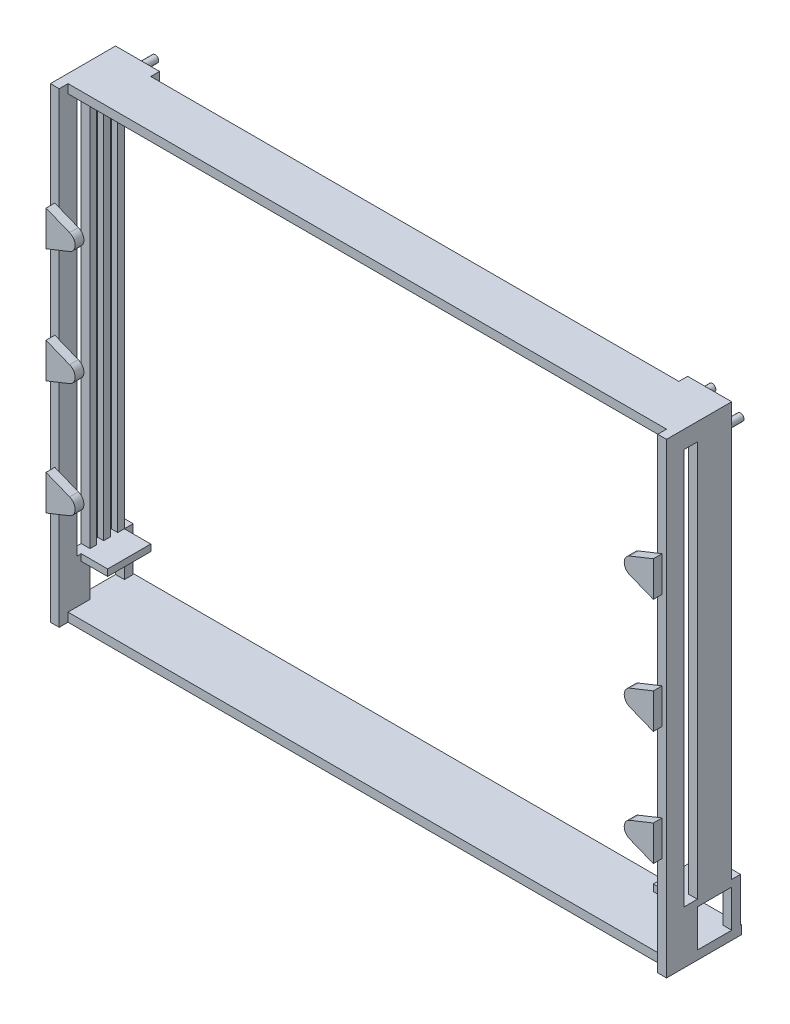
from build123d import *

# Parameters (mm, degrees)
ESQUISSE1_W                  = 10
ESQUISSE1_H                  = 25
BOSS_EXTRU_1_DEPTH           = 530
BOSS_EXTRU_1_2_DEPTH         = 530
BOSS_EXTRU_4_DEPTH           = 10
ESQUISSE8_W                  = 10
ESQUISSE8_H                  = 10
BOSS_EXTRU_5_DEPTH           = 60
ESQUISSE9_W                  = 60
ESQUISSE9_H                  = 10
BOSS_EXTRU_6_DEPTH           = 690
CONG_1_R                     = 10
CONG_2_R                     = 10
CONG_3_R                     = 10
CONG_4_R                     = 10
ESQUISSE10_W                 = 680
ESQUISSE10_H                 = 10
BOSS_EXTRU_7_DEPTH           = 15
ESQUISSE11_W                 = 10
ESQUISSE11_H                 = 50
BOSS_EXTRU_8_DEPTH           = 10
ESQUISSE12_W                 = 10
ESQUISSE12_H                 = 7.5
BOSS_EXTRU_9_DEPTH           = 39
ESQUISSE13_W                 = 49
ESQUISSE13_H                 = 7.5
BOSS_EXTRU_10_DEPTH          = 30
ESQUISSE19_W                 = 49
ESQUISSE19_H                 = 7.5
BOSS_EXTRU_14_DEPTH          = 30
ESQUISSE14_W                 = 10
ESQUISSE14_H                 = 49
BOSS_EXTRU_11_DEPTH          = 470
ESQUISSE16_W                 = 10
ESQUISSE16_H                 = 10
BOSS_EXTRU_12_DEPTH          = 20
ESQUISSE20_W                 = 10
ESQUISSE20_H                 = 10
BOSS_EXTRU_15_DEPTH          = 20
BOSS_EXTRU_16_REACH          = 876.2
ESQUISSE21_W                 = 54
ESQUISSE21_H                 = 10
ENL_V_MAT_EXTRU_1_DEPTH      = 875.199633951
ENL_V_MAT_EXTRU_1_DEPTH_BACK = 875.199633951
ESQUISSE22_W                 = 15
ESQUISSE22_H                 = 450
ESQUISSE23_W                 = 10
ESQUISSE23_H                 = 7.5
BOSS_EXTRU_17_DEPTH          = 10
BOSS_EXTRU_18_REACH          = 853.605
ESQUISSE24_W                 = 10
ESQUISSE24_H                 = 10
ESQUISSE25_W                 = 10
ESQUISSE25_H                 = 7.5
BOSS_EXTRU_19_DEPTH          = 10
BOSS_EXTRU_20_REACH          = 853.605
ESQUISSE26_W                 = 10
ESQUISSE26_H                 = 10
ESQUISSE28_W                 = 8
ESQUISSE28_H                 = 450
ENL_V_MAT_EXTRU_2_DEPTH      = 7
ESQUISSE29_W                 = 8
ESQUISSE29_H                 = 450
ENL_V_MAT_EXTRU_3_DEPTH      = 7
ESQUISSE31_W                 = 20
ESQUISSE31_H                 = 10
BOSS_EXTRU_22_DEPTH          = 10
ESQUISSE33_R                 = 4
BOSS_EXTRU_23_DEPTH          = 8
ESQUISSE34_R                 = 4
BOSS_EXTRU_24_DEPTH          = 15
ESQUISSE35_R                 = 4
BOSS_EXTRU_25_DEPTH          = 15
ESQUISSE36_R                 = 4
BOSS_EXTRU_26_DEPTH          = 8


with BuildPart() as part:
    # Esquisse1 → Boss.-Extru.1 (new body)
    with BuildSketch(Plane(origin=(0, 0, 0), x_dir=(1, 0, 0), z_dir=(0, 1, 0))):
        with Locations((5, 12.5)):
            Rectangle(ESQUISSE1_W, ESQUISSE1_H)
    extrude(amount=BOSS_EXTRU_1_DEPTH)

    # Esquisse7 → Boss.-Extru.4 (add)
    with BuildSketch(Plane.XY):
        Polygon((5, 415), (55, 395), (5, 375), align=None)
        Polygon((5, 285), (55, 265), (5, 245), align=None)
        Polygon((5, 155), (55, 135), (5, 115), align=None)
        Polygon((695, 115), (695, 155), (645, 135), align=None)
        Polygon((695, 245), (695, 285), (645, 265), align=None)
        Polygon((695, 375), (695, 415), (645, 395), align=None)
    extrude(amount=BOSS_EXTRU_4_DEPTH)


with BuildPart() as body_2:
    # Esquisse1 → Boss.-Extru.1 2 (new body)
    with BuildSketch(Plane(origin=(0, 0, 0), x_dir=(1, 0, 0), z_dir=(0, 1, 0))):
        with Locations((695, 12.5)):
            Rectangle(ESQUISSE1_W, ESQUISSE1_H)
    extrude(amount=BOSS_EXTRU_1_2_DEPTH)



with BuildPart() as boss_extru_4_piece_1:
    # of the separate pieces the step leaves, piece 1, a body of its own (boss_extru_4_pieces)
    add(part.part.solids().sort_by_distance((0, 0, 0))[0])

    # Esquisse8 → Boss.-Extru.5 (add)
    with BuildSketch(Plane(origin=(0, 0, -25), x_dir=(-1, 0, 0), z_dir=(0, 0, -1))):
        with Locations((-5, 5)):
            Rectangle(ESQUISSE8_W, ESQUISSE8_H)
    extrude(amount=BOSS_EXTRU_5_DEPTH)


with BuildPart() as boss_extru_4_piece_2:
    # of the separate pieces the step leaves, piece 2, a body of its own (boss_extru_4_pieces)
    add(part.part.solids().sort_by_distance((695, 115, 0))[0])

    # Congé4
    cong_4_edges = [boss_extru_4_piece_2.edges().sort_by_distance(p)[0] for p in [
        (645, 135, 5),
    ]]
    fillet(cong_4_edges, radius=CONG_4_R)


with BuildPart() as boss_extru_4_piece_3:
    # of the separate pieces the step leaves, piece 3, a body of its own (boss_extru_4_pieces)
    add(part.part.solids().sort_by_distance((695, 245, 0))[0])

    # Congé3
    cong_3_edges = [boss_extru_4_piece_3.edges().sort_by_distance(p)[0] for p in [
        (645, 265, 5),
    ]]
    fillet(cong_3_edges, radius=CONG_3_R)


with BuildPart() as boss_extru_4_piece_4:
    # of the separate pieces the step leaves, piece 4, a body of its own (boss_extru_4_pieces)
    add(part.part.solids().sort_by_distance((695, 375, 0))[0])

    # Congé2
    cong_2_edges = [boss_extru_4_piece_4.edges().sort_by_distance(p)[0] for p in [
        (645, 395, 5),
    ]]
    fillet(cong_2_edges, radius=CONG_2_R)


with BuildPart() as body_2_1:
    add(body_2.part)

    add(boss_extru_4_piece_1.part)  # Boss.-Extru.6 merges Boss.-Extru.4 piece 1
    # Esquisse9 → Boss.-Extru.6 (add)
    with BuildSketch(Plane(origin=(10, 0, 0), x_dir=(0, 0, -1), z_dir=(1, 0, 0))):
        with Locations((55, 5)):
            Rectangle(ESQUISSE9_W, ESQUISSE9_H)
    extrude(amount=BOSS_EXTRU_6_DEPTH)

    # Congé1
    cong_1_edges = [body_2_1.edges().sort_by_distance(p)[0] for p in [
        (55, 395, 5),
        (55, 135, 5),
        (55, 265, 5),
    ]]
    fillet(cong_1_edges, radius=CONG_1_R)

    # Esquisse10 → Boss.-Extru.7 (add)
    with BuildSketch(Plane.XY.offset(-25)):
        with Locations((350, 5)):
            Rectangle(ESQUISSE10_W, ESQUISSE10_H)
    extrude(amount=BOSS_EXTRU_7_DEPTH)

    # Esquisse11 → Boss.-Extru.8 (add)
    with BuildSketch(Plane(origin=(0, 0, -25), x_dir=(-1, 0, 0), z_dir=(0, 0, -1))):
        with Locations((-695, 35)):
            Rectangle(ESQUISSE11_W, ESQUISSE11_H)
        with Locations((-5, 35)):
            Rectangle(ESQUISSE11_W, ESQUISSE11_H)
    extrude(amount=BOSS_EXTRU_8_DEPTH)

    # Esquisse12 → Boss.-Extru.9 (add)
    with BuildSketch(Plane(origin=(0, 0, -35), x_dir=(-1, 0, 0), z_dir=(0, 0, -1))):
        with Locations((-695, 56.25)):
            Rectangle(ESQUISSE12_W, ESQUISSE12_H)
        with Locations((-5, 56.25)):
            Rectangle(ESQUISSE12_W, ESQUISSE12_H)
    extrude(amount=BOSS_EXTRU_9_DEPTH)

    # Esquisse13 → Boss.-Extru.10 (add)
    with BuildSketch(Plane.ZY.offset(-690)):
        with Locations((-49.5, 56.25)):
            Rectangle(ESQUISSE13_W, ESQUISSE13_H)
    extrude(amount=BOSS_EXTRU_10_DEPTH)

    # Esquisse19 → Boss.-Extru.14 (add)
    with BuildSketch(Plane(origin=(10, 0, 0), x_dir=(0, 0, -1), z_dir=(1, 0, 0))):
        with Locations((49.5, 56.25)):
            Rectangle(ESQUISSE19_W, ESQUISSE19_H)
    extrude(amount=BOSS_EXTRU_14_DEPTH)

    # Esquisse14 → Boss.-Extru.11 (add)
    with BuildSketch(Plane(origin=(0, 60, 0), x_dir=(1, 0, 0), z_dir=(0, 1, 0))):
        with Locations((695, 49.5)):
            Rectangle(ESQUISSE14_W, ESQUISSE14_H)
        with Locations((5, 49.5)):
            Rectangle(ESQUISSE14_W, ESQUISSE14_H)
    extrude(amount=BOSS_EXTRU_11_DEPTH)

    # Esquisse16 → Boss.-Extru.12 (add)
    with BuildSketch(Plane.ZY.offset(-690)):
        with Locations((-69, 525)):
            Rectangle(ESQUISSE16_W, ESQUISSE16_H)
    extrude(amount=BOSS_EXTRU_12_DEPTH)

    # Esquisse20 → Boss.-Extru.15 (add)
    with BuildSketch(Plane(origin=(10, 0, 0), x_dir=(0, 0, -1), z_dir=(1, 0, 0))):
        with Locations((69, 525)):
            Rectangle(ESQUISSE20_W, ESQUISSE20_H)
    extrude(amount=BOSS_EXTRU_15_DEPTH)

    # Esquisse21 → Boss.-Extru.16 (add, up to next)
    with BuildSketch(Plane(origin=(10, 0, 0), x_dir=(0, 0, -1), z_dir=(1, 0, 0)), mode=Mode.PRIVATE) as boss_extru_16_sk1:
        with Locations((37, 525)):
            Rectangle(ESQUISSE21_W, ESQUISSE21_H)
    boss_extru_16_tool1 = extrude(boss_extru_16_sk1.sketch, amount=BOSS_EXTRU_16_REACH, mode=Mode.PRIVATE) - body_2_1.part
    add(boss_extru_16_tool1.solids().sort_by_distance((10, 525, -37))[0])

    # Esquisse22 → Enlèv. mat.-Extru.1 (cut, two sides: drawn at the far end of the back side and taken through both)
    with BuildSketch(Plane.ZY.offset(-690).offset(-ENL_V_MAT_EXTRU_1_DEPTH_BACK)):
        with Locations((-27.5, 285)):
            Rectangle(ESQUISSE22_W, ESQUISSE22_H)
    extrude(amount=ENL_V_MAT_EXTRU_1_DEPTH + ENL_V_MAT_EXTRU_1_DEPTH_BACK, mode=Mode.SUBTRACT)

    # Esquisse23 → Boss.-Extru.17 (add)
    with BuildSketch(Plane(origin=(0, 0, -74), x_dir=(-1, 0, 0), z_dir=(0, 0, -1))):
        with Locations((-695, 56.25)):
            Rectangle(ESQUISSE23_W, ESQUISSE23_H)
    extrude(amount=BOSS_EXTRU_17_DEPTH)

    # Esquisse24 → Boss.-Extru.18 (add, up to next)
    with BuildSketch(Plane.XZ.offset(-52.5), mode=Mode.PRIVATE) as boss_extru_18_sk1:
        with Locations((695, -79)):
            Rectangle(ESQUISSE24_W, ESQUISSE24_H)
    boss_extru_18_tool1 = extrude(boss_extru_18_sk1.sketch, amount=BOSS_EXTRU_18_REACH, mode=Mode.PRIVATE) - body_2_1.part
    add(boss_extru_18_tool1.solids().sort_by_distance((695, 52.5, -79))[0])

    # Esquisse25 → Boss.-Extru.19 (add)
    with BuildSketch(Plane(origin=(0, 0, -74), x_dir=(-1, 0, 0), z_dir=(0, 0, -1))):
        with Locations((-5, 56.25)):
            Rectangle(ESQUISSE25_W, ESQUISSE25_H)
    extrude(amount=BOSS_EXTRU_19_DEPTH)

    # Esquisse26 → Boss.-Extru.20 (add, up to next)
    with BuildSketch(Plane.XZ.offset(-52.5), mode=Mode.PRIVATE) as boss_extru_20_sk1:
        with Locations((5, -79)):
            Rectangle(ESQUISSE26_W, ESQUISSE26_H)
    boss_extru_20_tool1 = extrude(boss_extru_20_sk1.sketch, amount=BOSS_EXTRU_20_REACH, mode=Mode.PRIVATE) - body_2_1.part
    add(boss_extru_20_tool1.solids().sort_by_distance((5, 52.5, -79))[0])

    # Esquisse28 → Enlèv. mat.-Extru.2 (cut)
    with BuildSketch(Plane.ZY.offset(-690)):
        with Locations((-62.5, 285)):
            Rectangle(ESQUISSE28_W, ESQUISSE28_H)
        with Locations((-46.5, 285)):
            Rectangle(ESQUISSE28_W, ESQUISSE28_H)
    extrude(amount=-ENL_V_MAT_EXTRU_2_DEPTH, mode=Mode.SUBTRACT)

    # Esquisse29 → Enlèv. mat.-Extru.3 (cut)
    with BuildSketch(Plane(origin=(10, 0, 0), x_dir=(0, 0, -1), z_dir=(1, 0, 0))):
        with Locations((46.5, 285)):
            Rectangle(ESQUISSE29_W, ESQUISSE29_H)
        with Locations((62.5, 285)):
            Rectangle(ESQUISSE29_W, ESQUISSE29_H)
    extrude(amount=-ENL_V_MAT_EXTRU_3_DEPTH, mode=Mode.SUBTRACT)

    # Esquisse31 → Boss.-Extru.22 (add)
    with BuildSketch(Plane(origin=(0, 0, -64), x_dir=(-1, 0, 0), z_dir=(0, 0, -1))):
        with Locations((-660, 525)):
            Rectangle(ESQUISSE31_W, ESQUISSE31_H)
        with Locations((-40, 525)):
            Rectangle(ESQUISSE31_W, ESQUISSE31_H)
    extrude(amount=BOSS_EXTRU_22_DEPTH)

    # Esquisse33 → Boss.-Extru.23 (add)
    with BuildSketch(Plane(origin=(0, 0, -74), x_dir=(-1, 0, 0), z_dir=(0, 0, -1))):
        with Locations((-670, 525)):
            Circle(ESQUISSE33_R)
    extrude(amount=BOSS_EXTRU_23_DEPTH)

    # Esquisse34 → Boss.-Extru.24 (add)
    with BuildSketch(Plane(origin=(0, 0, -74), x_dir=(-1, 0, 0), z_dir=(0, 0, -1))):
        with Locations((-695, 505)):
            Circle(ESQUISSE34_R)
    extrude(amount=BOSS_EXTRU_24_DEPTH)

    # Esquisse35 → Boss.-Extru.25 (add)
    with BuildSketch(Plane(origin=(0, 0, -74), x_dir=(-1, 0, 0), z_dir=(0, 0, -1))):
        with Locations((-30, 525)):
            Circle(ESQUISSE35_R)
    extrude(amount=BOSS_EXTRU_25_DEPTH)

    # Esquisse36 → Boss.-Extru.26 (add)
    with BuildSketch(Plane(origin=(0, 0, -74), x_dir=(-1, 0, 0), z_dir=(0, 0, -1))):
        with Locations((-5, 505)):
            Circle(ESQUISSE36_R)
    extrude(amount=BOSS_EXTRU_26_DEPTH)


solid = Compound([boss_extru_4_piece_2.part, boss_extru_4_piece_3.part, boss_extru_4_piece_4.part, body_2_1.part])
